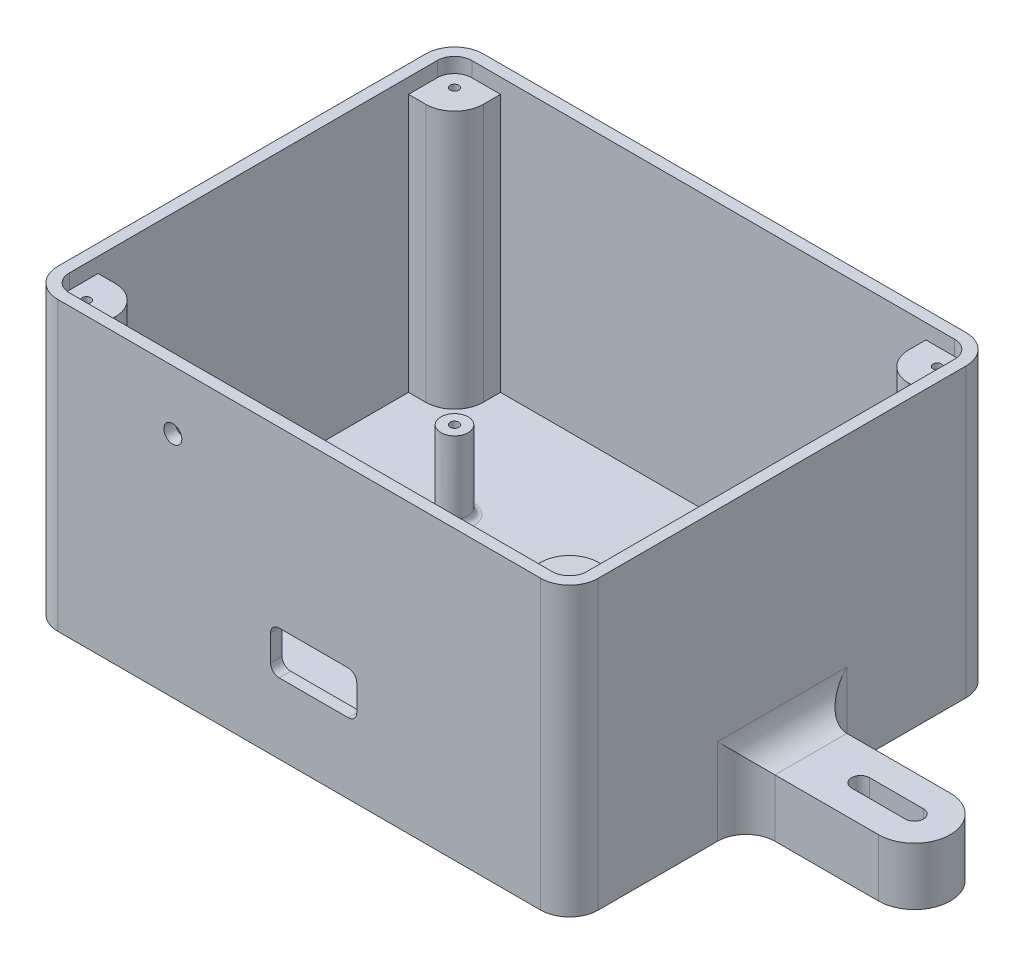
from build123d import *

# Parameters (mm, degrees)
ESBO_O1_W                                  = 4.75
ESBO_O1_H                                  = 1
REVOLU_O1_ANGLE                            = 180
ESBO_O2_W                                  = 9.5
ESBO_O2_H                                  = 74
RESSALTO_EXTRUS_O1_DEPTH                   = 8.75
ESBO_O3_W                                  = 8.75
ESBO_O3_H                                  = 73
CORTE_EXTRUS_O1_DEPTH                      = 1.5
ESBO_O4_W                                  = 8
ESBO_O4_H                                  = 73
CORTE_EXTRUS_O2_DEPTH                      = 4.75
ESBO_O5_W                                  = 4
ESBO_O5_H                                  = 68
RESSALTO_EXTRUS_O2_DEPTH                   = 52
ESBO_O6_W                                  = 4
ESBO_O6_H                                  = 74
RESSALTO_EXTRUS_O3_DEPTH                   = 80
ESBO_O7_W                                  = 4
ESBO_O7_H                                  = 74
RESSALTO_EXTRUS_O4_DEPTH                   = 40
ESBO_O8_W                                  = 144
ESBO_O8_H                                  = 74
RESSALTO_EXTRUS_O5_DEPTH                   = 4
ESBO_O9_W                                  = 144
ESBO_O9_H                                  = 74
RESSALTO_EXTRUS_O6_DEPTH                   = 4
ESBO_O10_W                                 = 188
ESBO_O10_H                                 = 74
RESSALTO_EXTRUS_O7_DEPTH                   = 4
ESBO_O11_W                                 = 188
ESBO_O11_H                                 = 148
RESSALTO_EXTRUS_O8_DEPTH                   = 26
CORTE_EXTRUS_O3_DEPTH                      = 21
RESSALTO_EXTRUS_O9_DEPTH                   = 20
CORTE_EXTRUS_O4_DEPTH                      = 268.847437919
RESSALTO_EXTRUS_O10_DEPTH                  = 20
CORTE_EXTRUS_O5_DEPTH                      = 262.040705638
ESBO_O17_W                                 = 16
ESBO_O17_H                                 = 16
RESSALTO_EXTRUS_O11_DEPTH                  = 90
ESBO_O18_W                                 = 16
ESBO_O18_H                                 = 16
RESSALTO_EXTRUS_O12_DEPTH                  = 90
ESBO_O19_W                                 = 16
ESBO_O19_H                                 = 16
RESSALTO_EXTRUS_O13_DEPTH                  = 90
ESBO_O20_W                                 = 16
ESBO_O20_H                                 = 16
RESSALTO_EXTRUS_O14_DEPTH                  = 90
RESSALTO_EXTRUS_O15_DEPTH                  = 22
ESBO_O22_W                                 = 4.75
ESBO_O22_H                                 = 22
FURO_DE_DI_METRO_3_0_3_1_D                 = 3
FURO_DE_DI_METRO_3_0_3_1_DEPTH             = 15
FURO_DE_DI_METRO_3_0_3_1_TIP               = 0.901290929
FURO_DE_DI_METRO_3_0_3_2_D                 = 3
FURO_DE_DI_METRO_3_0_3_2_DEPTH             = 15
FURO_DE_DI_METRO_3_0_3_2_TIP               = 0.901290929
BROCA_DE_ROSQUEAR_PARA_HELICOIDE_M61_D     = 6.25
BROCA_DE_ROSQUEAR_PARA_HELICOIDE_M61_DEPTH = 4
CHANFRO1_SIZE                              = 0.025
FILETE1_R                                  = 2
FILETE2_R                                  = 10
ESBO_O35_W                                 = 4.75
ESBO_O35_H                                 = 22
FILETE3_R                                  = 2
ESBO_O43_W                                 = 52
ESBO_O43_H                                 = 6
RESSALTO_EXTRUS_O16_DEPTH                  = 4
ESBO_O44_R                                 = 4.75
ESBO_O44_R_2                               = 1.525
RESSALTO_EXTRUS_O17_DEPTH                  = 5
CORTE_EXTRUS_O7_DEPTH                      = 10
CORTE_EXTRUS_O8_DEPTH                      = 5.2


with BuildPart() as part:
    # Esboço1 → Revolução1 (revolve)
    with BuildSketch(Plane.XY.offset(-4.75)):
        with Locations((97.625, 26.5)):
            Rectangle(ESBO_O1_W, ESBO_O1_H)
    revolve(axis=Axis((95.25, 27, -4.75), (0, 1, 0)), revolution_arc=REVOLU_O1_ANGLE)

    # Esboço2 → Ressalto-extrusão1 (add)
    with BuildSketch(Plane.XY.offset(-4.75)):
        with Locations((95.25, 63)):
            Rectangle(ESBO_O2_W, ESBO_O2_H)
    extrude(amount=RESSALTO_EXTRUS_O1_DEPTH)

    # Esboço3 → Corte-extrusão1 (cut)
    with BuildSketch(Plane.ZY.offset(-90.5)):
        with Locations((-0.375, 63.5)):
            Rectangle(ESBO_O3_W, ESBO_O3_H)
    extrude(amount=-CORTE_EXTRUS_O1_DEPTH, mode=Mode.SUBTRACT)

    # Esboço4 → Corte-extrusão2 (cut)
    with BuildSketch(Plane(origin=(0, 0, -4.75), x_dir=(-1, 0, 0), z_dir=(0, 0, -1))):
        with Locations((-96, 63.5)):
            Rectangle(ESBO_O4_W, ESBO_O4_H)
    extrude(amount=-CORTE_EXTRUS_O2_DEPTH, mode=Mode.SUBTRACT)

    # Esboço5 → Ressalto-extrusão2 (add)
    with BuildSketch(Plane.ZY.offset(-92)):
        with Locations((2, 66)):
            Rectangle(ESBO_O5_W, ESBO_O5_H)
    extrude(amount=RESSALTO_EXTRUS_O2_DEPTH)

    # Esboço6 → Ressalto-extrusão3 (add)
    with BuildSketch(Plane.ZY.offset(-40)):
        with Locations((2, 63)):
            Rectangle(ESBO_O6_W, ESBO_O6_H)
    extrude(amount=RESSALTO_EXTRUS_O3_DEPTH)

    # Esboço7 → Ressalto-extrusão4 (add)
    with BuildSketch(Plane(origin=(100, 0, 0), x_dir=(0, 0, -1), z_dir=(1, 0, 0))):
        with Locations((-2, 63)):
            Rectangle(ESBO_O7_W, ESBO_O7_H)
    extrude(amount=RESSALTO_EXTRUS_O4_DEPTH)

    # Esboço8 → Ressalto-extrusão5 (add)
    with BuildSketch(Plane(origin=(140, 0, 0), x_dir=(0, 0, -1), z_dir=(1, 0, 0))):
        with Locations((68, 63)):
            Rectangle(ESBO_O8_W, ESBO_O8_H)
    extrude(amount=RESSALTO_EXTRUS_O5_DEPTH)

    # Esboço9 → Ressalto-extrusão6 (add)
    with BuildSketch(Plane.ZY.offset(40)):
        with Locations((-68, 63)):
            Rectangle(ESBO_O9_W, ESBO_O9_H)
    extrude(amount=RESSALTO_EXTRUS_O6_DEPTH)

    # Esboço10 → Ressalto-extrusão7 (add)
    with BuildSketch(Plane(origin=(0, 0, -140), x_dir=(-1, 0, 0), z_dir=(0, 0, -1))):
        with Locations((-50, 63)):
            Rectangle(ESBO_O10_W, ESBO_O10_H)
    extrude(amount=RESSALTO_EXTRUS_O7_DEPTH)

    # Esboço11 → Ressalto-extrusão8 (add)
    with BuildSketch(Plane.XZ.offset(-26)):
        with Locations((50, -70)):
            Rectangle(ESBO_O11_W, ESBO_O11_H)
    extrude(amount=RESSALTO_EXTRUS_O8_DEPTH)

    # Esboço12 → Corte-extrusão3 (cut)
    with BuildSketch(Plane(origin=(0, 26, 0), x_dir=(-1, 0, 0), z_dir=(0, 1, 0))):
        with BuildLine():
            Line((-140, -140), (40, -140))
            Line((40, -140), (40, 0))
            Line((40, 0), (-90.5, 0))
            Line((-90.5, 0), (-90.5, -4.75))
            ThreePointArc((-90.5, -4.75), (-95.25, -9.5), (-100, -4.75))
            Line((-100, -4.75), (-100, 0))
            Line((-100, 0), (-140, 0))
            Line((-140, 0), (-140, -140))
        make_face()
    extrude(amount=-CORTE_EXTRUS_O3_DEPTH, mode=Mode.SUBTRACT)

    # Esboço13 → Ressalto-extrusão9 (add)
    with BuildSketch(Plane.XZ):
        with BuildLine():
            Line((144, -82.5), (190, -82.5))
            ThreePointArc((190, -82.5), (202.5, -70), (190, -57.5))
            Line((190, -57.5), (144, -57.5))
            Line((144, -57.5), (144, -82.5))
        make_face()
    extrude(amount=-RESSALTO_EXTRUS_O9_DEPTH)

    # Esboço14 → Corte-extrusão4 (cut, through all)
    with BuildSketch(Plane.XZ):
        with BuildLine():
            Line((190, -66.875), (171.25, -66.875))
            ThreePointArc((171.25, -66.875), (168.125, -70), (171.25, -73.125))
            Line((171.25, -73.125), (190, -73.125))
            ThreePointArc((190, -73.125), (193.125, -70), (190, -66.875))
        make_face()
    extrude(amount=-CORTE_EXTRUS_O4_DEPTH, mode=Mode.SUBTRACT)

    # Esboço15 → Ressalto-extrusão10 (add)
    with BuildSketch(Plane.XZ):
        with BuildLine():
            Line((-44, -57.5), (-90, -57.5))
            ThreePointArc((-90, -57.5), (-102.5, -70), (-90, -82.5))
            Line((-90, -82.5), (-44, -82.5))
            Line((-44, -82.5), (-44, -57.5))
        make_face()
    extrude(amount=-RESSALTO_EXTRUS_O10_DEPTH)

    # Esboço16 → Corte-extrusão5 (cut, through all)
    with BuildSketch(Plane(origin=(0, 20, 0), x_dir=(-1, 0, 0), z_dir=(0, 1, 0))):
        with BuildLine():
            Line((71.25, -73.125), (90, -73.125))
            ThreePointArc((90, -73.125), (93.125, -70), (90, -66.875))
            Line((90, -66.875), (71.25, -66.875))
            ThreePointArc((71.25, -66.875), (68.125, -70), (71.25, -73.125))
        make_face()
    extrude(amount=-CORTE_EXTRUS_O5_DEPTH, mode=Mode.SUBTRACT)

    # Esboço17 → Ressalto-extrusão11 (add)
    with BuildSketch(Plane(origin=(0, 5, 0), x_dir=(-1, 0, 0), z_dir=(0, 1, 0))):
        with Locations((32, -132)):
            Rectangle(ESBO_O17_W, ESBO_O17_H)
    extrude(amount=RESSALTO_EXTRUS_O11_DEPTH)

    # Esboço18 → Ressalto-extrusão12 (add)
    with BuildSketch(Plane(origin=(0, 5, 0), x_dir=(-1, 0, 0), z_dir=(0, 1, 0))):
        with Locations((-132, -132)):
            Rectangle(ESBO_O18_W, ESBO_O18_H)
    extrude(amount=RESSALTO_EXTRUS_O12_DEPTH)

    # Esboço19 → Ressalto-extrusão13 (add)
    with BuildSketch(Plane(origin=(0, 5, 0), x_dir=(-1, 0, 0), z_dir=(0, 1, 0))):
        with Locations((-132, -8)):
            Rectangle(ESBO_O19_W, ESBO_O19_H)
    extrude(amount=RESSALTO_EXTRUS_O13_DEPTH)

    # Esboço20 → Ressalto-extrusão14 (add)
    with BuildSketch(Plane(origin=(0, 5, 0), x_dir=(-1, 0, 0), z_dir=(0, 1, 0))):
        with Locations((32, -8)):
            Rectangle(ESBO_O20_W, ESBO_O20_H)
    extrude(amount=RESSALTO_EXTRUS_O14_DEPTH)

    # Esboço21 → Ressalto-extrusão15 (add)
    with BuildSketch(Plane(origin=(0, 5, 0), x_dir=(-1, 0, 0), z_dir=(0, 1, 0))):
        with BuildLine():
            Line((-9.5, -4.75), (-9.5, 0))
            Line((-9.5, 0), (0, 0))
            Line((0, 0), (0, -4.75))
            ThreePointArc((0, -4.75), (-4.75, -9.5), (-9.5, -4.75))
        make_face()
    extrude(amount=RESSALTO_EXTRUS_O15_DEPTH)

    # Esboço22 → Revolução2 (revolve)
    with BuildSketch(Plane.XY.offset(-95.25)):
        with Locations((7.125, 16)):
            Rectangle(ESBO_O22_W, ESBO_O22_H)
    revolve(axis=Axis((4.75, 27, -95.25), (0, -1, 0)))

    # Furo de diâmetro Ø3.0 (3)1
    with Locations(Plane(origin=(0, 95, 0), x_dir=(1, 0, 0), z_dir=(0, 1, 0))):
        with Locations((-34, 6), (134, 6), (134, 134), (-34, 134)):
            Hole(FURO_DE_DI_METRO_3_0_3_1_D / 2, depth=FURO_DE_DI_METRO_3_0_3_1_DEPTH)
            with Locations((0, 0, -(FURO_DE_DI_METRO_3_0_3_1_DEPTH + FURO_DE_DI_METRO_3_0_3_1_TIP / 2))):  # 118° drill point
                Cone(0, FURO_DE_DI_METRO_3_0_3_1_D / 2, FURO_DE_DI_METRO_3_0_3_1_TIP, mode=Mode.SUBTRACT)

    # Furo de diâmetro Ø3.0 (3)2
    with Locations(Plane(origin=(0, 27, 0), x_dir=(1, 0, 0), z_dir=(0, 1, 0))):
        with Locations((95.25, 4.75), (4.75, 4.75), (4.75, 95.25)):
            Hole(FURO_DE_DI_METRO_3_0_3_2_D / 2, depth=FURO_DE_DI_METRO_3_0_3_2_DEPTH)
            with Locations((0, 0, -(FURO_DE_DI_METRO_3_0_3_2_DEPTH + FURO_DE_DI_METRO_3_0_3_2_TIP / 2))):  # 118° drill point
                Cone(0, FURO_DE_DI_METRO_3_0_3_2_D / 2, FURO_DE_DI_METRO_3_0_3_2_TIP, mode=Mode.SUBTRACT)

    # Broca de rosquear para helicoide M61
    with Locations(Plane.XY.offset(4)):
        with Locations((6, 79.5)):
            Hole(BROCA_DE_ROSQUEAR_PARA_HELICOIDE_M61_D / 2, depth=BROCA_DE_ROSQUEAR_PARA_HELICOIDE_M61_DEPTH)

    # Chanfro1
    chanfro1_edges = [part.edges().sort_by_distance(p)[0] for p in [
        (96.75, 27, -4.75),
        (6.25, 27, -95.25),
        (135.5, 95, -6),
        (-32.5, 95, -6),
        (6.25, 27, -4.75),
        (135.5, 95, -134),
        (-32.5, 95, -134),
    ]]
    chamfer(chanfro1_edges, length=CHANFRO1_SIZE)

    # Filete1
    filete1_edges = [part.edges().sort_by_distance(p)[0] for p in [
        (92, 32, 2),
        (40, 26, 2),
        (40, 32, 2),
    ]]
    fillet(filete1_edges, radius=FILETE1_R)

    # Filete2
    filete2_edges = [part.edges().sort_by_distance(p)[0] for p in [
        (124, 50, -124),
        (-44, 10, -82.5),
        (-44, 20, -70),
        (-44, 10, -57.5),
        (144, 10, -82.5),
        (144, 10, -57.5),
        (144, 20, -70),
        (140, 97.5, -140),
        (140, 97.5, 0),
        (-24, 50, -16),
        (-40, 97.5, 0),
        (-40, 97.5, -140),
        (144, 50, -144),
        (-24, 50, -124),
        (-44, 50, -144),
        (124, 50, -16),
        (-44, 50, 4),
        (144, 50, 4),
    ]]
    fillet(filete2_edges, radius=FILETE2_R)

    # Esboço35 → Revolução3 (revolve)
    with BuildSketch(Plane.XY.offset(-95.25)):
        with Locations((97.625, 16)):
            Rectangle(ESBO_O35_W, ESBO_O35_H)
    revolve(axis=Axis((95.25, 27, -95.25), (0, -1, 0)))

    # Esboço42 → Corte-Revolução1 (revolve, cut)
    with BuildSketch(Plane.XY.offset(-95.25)):
        Polygon((96.775, 27), (95.25, 27), (95.25, 11.098709071), (96.75, 12), (96.75, 26.975), align=None)
    revolve(axis=Axis((95.25, 27, -95.25), (0, -1, 0)), mode=Mode.SUBTRACT)

    # Filete3
    filete3_edges = [part.edges().sort_by_distance(p)[0] for p in [
        (0, 5, -2.375),
        (9.5, 5, -2.375),
        (4.75, 5, -9.5),
        (100, 5, -2.375),
        (95.25, 5, -9.5),
        (90.5, 5, -2.375),
        (90.5, 5, -95.25),
        (0, 5, -95.25),
    ]]
    fillet(filete3_edges, radius=FILETE3_R)

    # Esboço43 → Ressalto-extrusão16 (add)
    with BuildSketch(Plane.XY.offset(4)):
        with Locations((66, 29)):
            Rectangle(ESBO_O43_W, ESBO_O43_H)
    extrude(amount=-RESSALTO_EXTRUS_O16_DEPTH)

    # Esboço44 → Ressalto-extrusão17 (add, symmetric)
    # profile 1 of 4: a face of its own
    with BuildSketch(Plane(origin=(0, 27, 0), x_dir=(-1, 0, 0), z_dir=(0, 1, 0))):
        with Locations((-4.75, -95.25)):
            Circle(ESBO_O44_R)
        with Locations((-4.75, -95.25)):
            Circle(ESBO_O44_R_2, mode=Mode.SUBTRACT)
    # profile 2 of 4: a face of its own
    with BuildSketch(Plane(origin=(0, 27, 0), x_dir=(-1, 0, 0), z_dir=(0, 1, 0))):
        with Locations((-95.25, -95.25)):
            Circle(ESBO_O44_R)
        with Locations((-95.25, -95.25)):
            Circle(ESBO_O44_R_2, mode=Mode.SUBTRACT)
    # profile 3 of 4: a face of its own
    with BuildSketch(Plane(origin=(0, 27, 0), x_dir=(-1, 0, 0), z_dir=(0, 1, 0))):
        with BuildLine():
            Line((-9.5, -4.75), (-9.5, 0))
            Line((-9.5, 0), (0, 0))
            Line((0, 0), (0, -4.75))
            ThreePointArc((0, -4.75), (-4.75, -9.5), (-9.5, -4.75))
        make_face()
        with Locations((-4.75, -4.75)):
            Circle(ESBO_O44_R_2, mode=Mode.SUBTRACT)
    # profile 4 of 4: a face of its own
    with BuildSketch(Plane(origin=(0, 27, 0), x_dir=(-1, 0, 0), z_dir=(0, 1, 0))):
        with BuildLine():
            Line((-100, 0), (-100, -4.75))
            ThreePointArc((-100, -4.75), (-95.25, -9.5), (-90.5, -4.75))
            Line((-90.5, -4.75), (-90.5, 0))
            Line((-90.5, 0), (-100, 0))
        make_face()
        with Locations((-95.25, -4.75)):
            Circle(ESBO_O44_R_2, mode=Mode.SUBTRACT)
    extrude(amount=RESSALTO_EXTRUS_O17_DEPTH, both=True)

    # Esboço47 → Corte-extrusão7 (cut)
    with BuildSketch(Plane.XY.offset(4)):
        with BuildLine():
            Line((43, 39.5), (67, 39.5))
            ThreePointArc((67, 39.5), (69.121320344, 38.621320344), (70, 36.5))
            Line((70, 36.5), (70, 27.5))
            ThreePointArc((70, 27.5), (69.121320344, 25.378679656), (67, 24.5))
            Line((67, 24.5), (43, 24.5))
            ThreePointArc((43, 24.5), (40.878679656, 25.378679656), (40, 27.5))
            Line((40, 27.5), (40, 36.5))
            ThreePointArc((40, 36.5), (40.878679656, 38.621320344), (43, 39.5))
        make_face()
    extrude(amount=-CORTE_EXTRUS_O7_DEPTH, mode=Mode.SUBTRACT)

    # Esboço48 → Corte-extrusão8 (cut)
    with BuildSketch(Plane(origin=(0, 100, 0), x_dir=(1, 0, 0), z_dir=(0, 1, 0))):
        with BuildLine():
            Line((-34, 140), (-2.765132606, 140))
            Line((-2.765132606, 140), (-2.765132606, 108.90831793))
            Line((-2.765132606, 108.90831793), (-40, 108.90831793))
            Line((-40, 108.90831793), (-40, 134))
            ThreePointArc((-40, 134), (-38.242640687, 138.242640687), (-34, 140))
        make_face()
        with BuildLine():
            Line((140, 134), (140, 108.90831793))
            Line((140, 108.90831793), (102.765132606, 108.90831793))
            Line((102.765132606, 108.90831793), (102.765132606, 140))
            Line((102.765132606, 140), (134, 140))
            ThreePointArc((134, 140), (138.242640687, 138.242640687), (140, 134))
        make_face()
        with BuildLine():
            Line((-40, 6), (-40, 31.09168207))
            Line((-40, 31.09168207), (-2.765132606, 31.09168207))
            Line((-2.765132606, 31.09168207), (-2.765132606, 0))
            Line((-2.765132606, 0), (-34, 0))
            ThreePointArc((-34, 0), (-38.242640687, 1.757359313), (-40, 6))
        make_face()
        with BuildLine():
            Line((134, 0), (102.765132606, 0))
            Line((102.765132606, 0), (102.765132606, 31.09168207))
            Line((102.765132606, 31.09168207), (140, 31.09168207))
            Line((140, 31.09168207), (140, 6))
            ThreePointArc((140, 6), (138.242640687, 1.757359313), (134, 0))
        make_face()
    extrude(amount=-CORTE_EXTRUS_O8_DEPTH, mode=Mode.SUBTRACT)


solid = part.part
